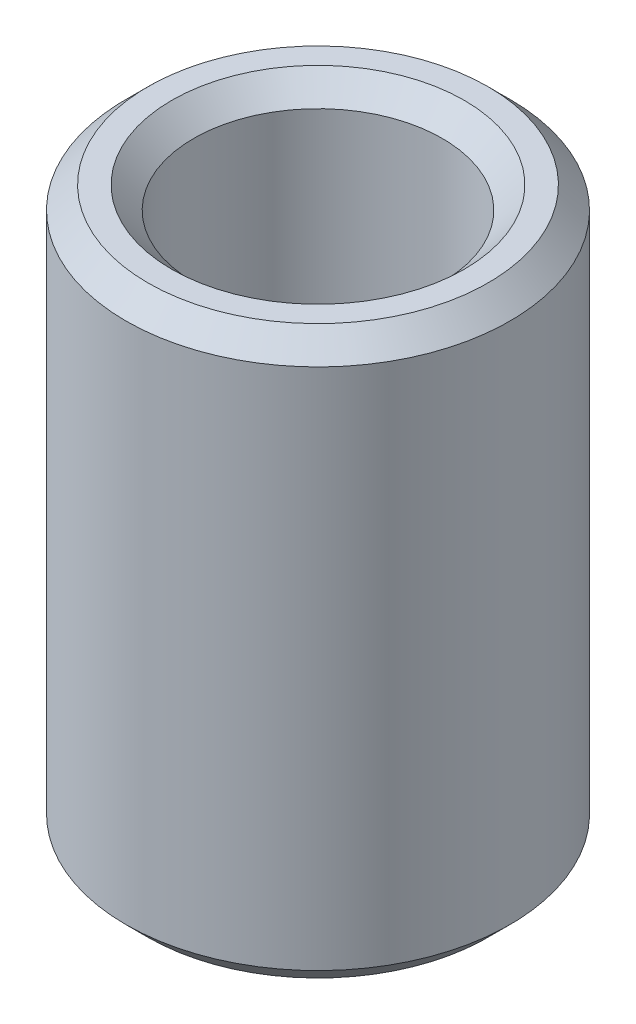
from build123d import *

# Parameters (mm, degrees)
SKETCH1_R           = 7.5
BOSS_EXTRUDE1_DEPTH = 22.136329724
SKETCH2_R           = 4.856817804
CUT_EXTRUDE1_DEPTH  = 25.546223613
CHAMFER1_SIZE       = 0.858426971


with BuildPart() as part:
    # Sketch1 → Boss-Extrude1 (new body)
    with BuildSketch(Plane(origin=(0, 0, 0), x_dir=(1, 0, 0), z_dir=(0, 1, 0))):
        Circle(SKETCH1_R)
    extrude(amount=BOSS_EXTRUDE1_DEPTH)

    # Sketch2 → Cut-Extrude1 (cut, through all)
    with BuildSketch(Plane(origin=(0, 0, 0), x_dir=(1, 0, 0), z_dir=(0, 1, 0))):
        Circle(SKETCH2_R)
    extrude(amount=CUT_EXTRUDE1_DEPTH, mode=Mode.SUBTRACT)

    # Chamfer1
    chamfer1_edges = [part.edges().sort_by_distance(p)[0] for p in [
        (-4.856817804, 22.136329724, 0),
        (-4.856817804, 0, 0),
        (-7.5, 0, 0),
        (-7.5, 22.136329724, 0),
    ]]
    chamfer(chamfer1_edges, length=CHAMFER1_SIZE)


solid = part.part
